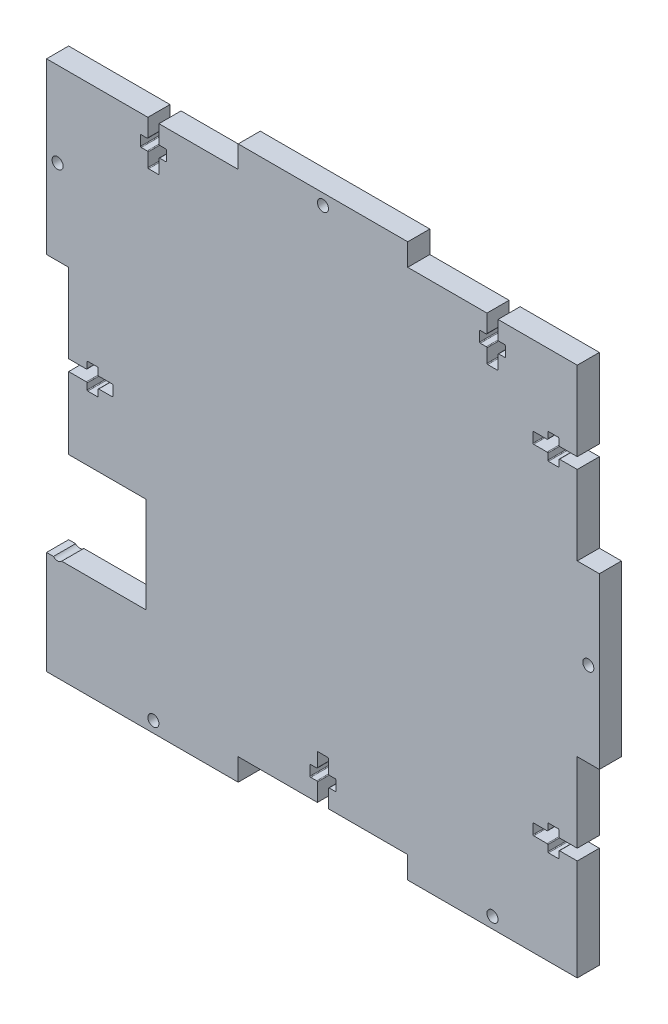
from build123d import *

# Parameters (mm, degrees)
BOX_SIDE_DEPTH       = 6
SKETCH2_R            = 1.5
SCREW_CUT_OUTS_DEPTH = 107.235587258
SKETCH3_W            = 27
SKETCH3_H            = 26
CUT_EXTRUDE1_DEPTH   = 107.235587258


with BuildPart() as part:
    # Sketch1 → Box Side (new body)
    with BuildSketch(Plane.XY):
        Polygon((-69, 69), (-23, 69), (-23, 75), (23, 75), (23, 69), (69, 69), (69, 23), (75, 23), (75, -23), (69, -23), (69, -69), (69, -75), (23, -75), (23, -69), (-23, -69), (-23, -75), (-69, -75), (-75, -75), (-75, -69), (-75, -23), (-69, -23), (-69, 23), (-75, 23), (-75, 69), align=None)
    extrude(amount=BOX_SIDE_DEPTH)

    # Sketch2 → Screw Cut-outs (cut, through all)
    with BuildSketch(Plane.XY.offset(6)):
        with Locations((0, 72)):
            Circle(SKETCH2_R)
        with Locations((72, 0)):
            Circle(SKETCH2_R)
        with Locations((-46, -72)):
            Circle(SKETCH2_R)
        with Locations((46, -72)):
            Circle(SKETCH2_R)
        with Locations((-72, 46)):
            Circle(SKETCH2_R)
        with Locations((-72, -46)):
            Circle(SKETCH2_R)
        with BuildLine():
            Line((-44.5, 69), (-44.5, 64.2))
            ThreePointArc((-44.5, 64.2), (-44.441421356, 64.058578644), (-44.3, 64))
            Line((-44.3, 64), (-42.7, 64))
            ThreePointArc((-42.7, 64), (-42.558578644, 63.941421356), (-42.5, 63.8))
            Line((-42.5, 63.8), (-42.5, 61.2))
            ThreePointArc((-42.5, 61.2), (-42.558578644, 61.058578644), (-42.7, 61))
            Line((-42.7, 61), (-44.3, 61))
            ThreePointArc((-44.3, 61), (-44.441421356, 60.941421356), (-44.5, 60.8))
            Line((-44.5, 60.8), (-44.5, 57.2))
            ThreePointArc((-44.5, 57.2), (-44.558578644, 57.058578644), (-44.7, 57))
            Line((-44.7, 57), (-47.3, 57))
            ThreePointArc((-47.3, 57), (-47.441421356, 57.058578644), (-47.5, 57.2))
            Line((-47.5, 57.2), (-47.5, 60.8))
            ThreePointArc((-47.5, 60.8), (-47.558578644, 60.941421356), (-47.7, 61))
            Line((-47.7, 61), (-49.3, 61))
            ThreePointArc((-49.3, 61), (-49.441421356, 61.058578644), (-49.5, 61.2))
            Line((-49.5, 61.2), (-49.5, 63.8))
            ThreePointArc((-49.5, 63.8), (-49.441421356, 63.941421356), (-49.3, 64))
            Line((-49.3, 64), (-47.7, 64))
            ThreePointArc((-47.7, 64), (-47.558578644, 64.058578644), (-47.5, 64.2))
            Line((-47.5, 64.2), (-47.5, 69))
            Line((-47.5, 69), (-44.5, 69))
        make_face()
        with BuildLine():
            Line((47.5, 69), (47.5, 64.2))
            ThreePointArc((47.5, 64.2), (47.558578644, 64.058578644), (47.7, 64))
            Line((47.7, 64), (49.3, 64))
            ThreePointArc((49.3, 64), (49.441421356, 63.941421356), (49.5, 63.8))
            Line((49.5, 63.8), (49.5, 61.2))
            ThreePointArc((49.5, 61.2), (49.441421356, 61.058578644), (49.3, 61))
            Line((49.3, 61), (47.7, 61))
            ThreePointArc((47.7, 61), (47.558578644, 60.941421356), (47.5, 60.8))
            Line((47.5, 60.8), (47.5, 57.2))
            ThreePointArc((47.5, 57.2), (47.441421356, 57.058578644), (47.3, 57))
            Line((47.3, 57), (44.7, 57))
            ThreePointArc((44.7, 57), (44.558578644, 57.058578644), (44.5, 57.2))
            Line((44.5, 57.2), (44.5, 60.8))
            ThreePointArc((44.5, 60.8), (44.441421356, 60.941421356), (44.3, 61))
            Line((44.3, 61), (42.7, 61))
            ThreePointArc((42.7, 61), (42.558578644, 61.058578644), (42.5, 61.2))
            Line((42.5, 61.2), (42.5, 63.8))
            ThreePointArc((42.5, 63.8), (42.558578644, 63.941421356), (42.7, 64))
            Line((42.7, 64), (44.3, 64))
            ThreePointArc((44.3, 64), (44.441421356, 64.058578644), (44.5, 64.2))
            Line((44.5, 64.2), (44.5, 69))
            Line((44.5, 69), (47.5, 69))
        make_face()
        with BuildLine():
            Line((69, 44.5), (64.2, 44.5))
            ThreePointArc((64.2, 44.5), (64.058578644, 44.441421356), (64, 44.3))
            Line((64, 44.3), (64, 42.7))
            ThreePointArc((64, 42.7), (63.941421356, 42.558578644), (63.8, 42.5))
            Line((63.8, 42.5), (61.2, 42.5))
            ThreePointArc((61.2, 42.5), (61.058578644, 42.558578644), (61, 42.7))
            Line((61, 42.7), (61, 44.3))
            ThreePointArc((61, 44.3), (60.941421356, 44.441421356), (60.8, 44.5))
            Line((60.8, 44.5), (57.2, 44.5))
            ThreePointArc((57.2, 44.5), (57.058578644, 44.558578644), (57, 44.7))
            Line((57, 44.7), (57, 47.3))
            ThreePointArc((57, 47.3), (57.058578644, 47.441421356), (57.2, 47.5))
            Line((57.2, 47.5), (60.8, 47.5))
            ThreePointArc((60.8, 47.5), (60.941421356, 47.558578644), (61, 47.7))
            Line((61, 47.7), (61, 49.3))
            ThreePointArc((61, 49.3), (61.058578644, 49.441421356), (61.2, 49.5))
            Line((61.2, 49.5), (63.8, 49.5))
            ThreePointArc((63.8, 49.5), (63.941421356, 49.441421356), (64, 49.3))
            Line((64, 49.3), (64, 47.7))
            ThreePointArc((64, 47.7), (64.058578644, 47.558578644), (64.2, 47.5))
            Line((64.2, 47.5), (69, 47.5))
            Line((69, 47.5), (69, 44.5))
        make_face()
        with BuildLine():
            Line((69, -47.5), (64.2, -47.5))
            ThreePointArc((64.2, -47.5), (64.058578644, -47.558578644), (64, -47.7))
            Line((64, -47.7), (64, -49.3))
            ThreePointArc((64, -49.3), (63.941421356, -49.441421356), (63.8, -49.5))
            Line((63.8, -49.5), (61.2, -49.5))
            ThreePointArc((61.2, -49.5), (61.058578644, -49.441421356), (61, -49.3))
            Line((61, -49.3), (61, -47.7))
            ThreePointArc((61, -47.7), (60.941421356, -47.558578644), (60.8, -47.5))
            Line((60.8, -47.5), (57.2, -47.5))
            ThreePointArc((57.2, -47.5), (57.058578644, -47.441421356), (57, -47.3))
            Line((57, -47.3), (57, -44.7))
            ThreePointArc((57, -44.7), (57.058578644, -44.558578644), (57.2, -44.5))
            Line((57.2, -44.5), (60.8, -44.5))
            ThreePointArc((60.8, -44.5), (60.941421356, -44.441421356), (61, -44.3))
            Line((61, -44.3), (61, -42.7))
            ThreePointArc((61, -42.7), (61.058578644, -42.558578644), (61.2, -42.5))
            Line((61.2, -42.5), (63.8, -42.5))
            ThreePointArc((63.8, -42.5), (63.941421356, -42.558578644), (64, -42.7))
            Line((64, -42.7), (64, -44.3))
            ThreePointArc((64, -44.3), (64.058578644, -44.441421356), (64.2, -44.5))
            Line((64.2, -44.5), (69, -44.5))
            Line((69, -44.5), (69, -47.5))
        make_face()
        with BuildLine():
            Line((-1.5, -69), (1.5, -69))
            Line((1.5, -69), (1.5, -64.2))
            ThreePointArc((1.5, -64.2), (1.558578644, -64.058578644), (1.7, -64))
            Line((1.7, -64), (3.3, -64))
            ThreePointArc((3.3, -64), (3.441421356, -63.941421356), (3.5, -63.8))
            Line((3.5, -63.8), (3.5, -61.2))
            ThreePointArc((3.5, -61.2), (3.441421356, -61.058578644), (3.3, -61))
            Line((3.3, -61), (1.7, -61))
            ThreePointArc((1.7, -61), (1.558578644, -60.941421356), (1.5, -60.8))
            Line((1.5, -60.8), (1.5, -57.2))
            ThreePointArc((1.5, -57.2), (1.441421356, -57.058578644), (1.3, -57))
            Line((1.3, -57), (-1.3, -57))
            ThreePointArc((-1.3, -57), (-1.441421356, -57.058578644), (-1.5, -57.2))
            Line((-1.5, -57.2), (-1.5, -60.8))
            ThreePointArc((-1.5, -60.8), (-1.558578644, -60.941421356), (-1.7, -61))
            Line((-1.7, -61), (-3.3, -61))
            ThreePointArc((-3.3, -61), (-3.441421356, -61.058578644), (-3.5, -61.2))
            Line((-3.5, -61.2), (-3.5, -63.8))
            ThreePointArc((-3.5, -63.8), (-3.441421356, -63.941421356), (-3.3, -64))
            Line((-3.3, -64), (-1.7, -64))
            ThreePointArc((-1.7, -64), (-1.558578644, -64.058578644), (-1.5, -64.2))
            Line((-1.5, -64.2), (-1.5, -69))
        make_face()
        with BuildLine():
            Line((-69, -1.5), (-64.2, -1.5))
            ThreePointArc((-64.2, -1.5), (-64.058578644, -1.558578644), (-64, -1.7))
            Line((-64, -1.7), (-64, -3.3))
            ThreePointArc((-64, -3.3), (-63.941421356, -3.441421356), (-63.8, -3.5))
            Line((-63.8, -3.5), (-61.2, -3.5))
            ThreePointArc((-61.2, -3.5), (-61.058578644, -3.441421356), (-61, -3.3))
            Line((-61, -3.3), (-61, -1.7))
            ThreePointArc((-61, -1.7), (-60.941421356, -1.558578644), (-60.8, -1.5))
            Line((-60.8, -1.5), (-57.2, -1.5))
            ThreePointArc((-57.2, -1.5), (-57.058578644, -1.441421356), (-57, -1.3))
            Line((-57, -1.3), (-57, 1.3))
            ThreePointArc((-57, 1.3), (-57.058578644, 1.441421356), (-57.2, 1.5))
            Line((-57.2, 1.5), (-60.8, 1.5))
            ThreePointArc((-60.8, 1.5), (-60.941421356, 1.558578644), (-61, 1.7))
            Line((-61, 1.7), (-61, 3.3))
            ThreePointArc((-61, 3.3), (-61.058578644, 3.441421356), (-61.2, 3.5))
            Line((-61.2, 3.5), (-63.8, 3.5))
            ThreePointArc((-63.8, 3.5), (-63.941421356, 3.441421356), (-64, 3.3))
            Line((-64, 3.3), (-64, 1.7))
            ThreePointArc((-64, 1.7), (-64.058578644, 1.558578644), (-64.2, 1.5))
            Line((-64.2, 1.5), (-69, 1.5))
            Line((-69, 1.5), (-69, -1.5))
        make_face()
    extrude(amount=-SCREW_CUT_OUTS_DEPTH, mode=Mode.SUBTRACT)

    # Sketch3 → Cut-Extrude1 (cut, through all)
    with BuildSketch(Plane.XY.offset(6)):
        with Locations((-61.5, -34)):
            Rectangle(SKETCH3_W, SKETCH3_H)
    extrude(amount=-CUT_EXTRUDE1_DEPTH, mode=Mode.SUBTRACT)


solid = part.part
